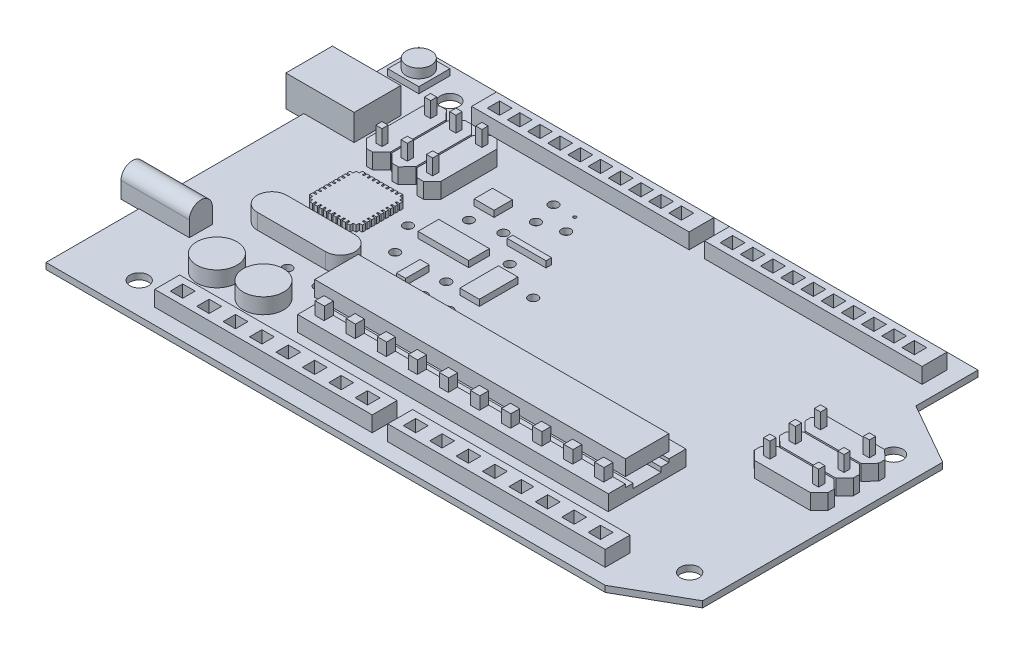
from build123d import *

# Parameters (mm, degrees)
BOSS_EXTRUDE2_DEPTH       = 2
SKETCH3_W                 = 70
SKETCH3_H                 = 8
BOSS_EXTRUDE3_DEPTH       = 5
SKETCH4_W                 = 4
SKETCH4_H                 = 4
CUT_EXTRUDE1_DEPTH        = 4
LPATTERN3_COUNT           = 10
LPATTERN3_PITCH           = 6.5
SKETCH5_W                 = 4
SKETCH5_H                 = 4
CUT_EXTRUDE2_DEPTH        = 4
LPATTERN4_COUNT           = 10
LPATTERN4_PITCH           = 6.5
SKETCH6_W                 = 70
SKETCH6_H                 = 8
BOSS_EXTRUDE7_DEPTH       = 5
SKETCH7_W                 = 4
SKETCH7_H                 = 4
CUT_EXTRUDE3_DEPTH        = 4
LPATTERN5_COUNT           = 8
LPATTERN5_PITCH           = 8.5
SKETCH8_W                 = 4
SKETCH8_H                 = 4
CUT_EXTRUDE4_DEPTH        = 4
LPATTERN6_COUNT           = 8
LPATTERN6_PITCH           = 8.5
SKETCH9_R                 = 3
CUT_EXTRUDE5_DEPTH        = 4
SKETCH10_W                = 100
SKETCH10_H                = 25
BOSS_EXTRUDE8_DEPTH       = 5
SKETCH11_W                = 9
SKETCH11_H                = 2.5
CUT_EXTRUDE6_DEPTH        = 100
SKETCH13_W                = 3
SKETCH13_H                = 3
CUT_EXTRUDE7_DEPTH        = 4
LPATTERN7_COUNT           = 10
LPATTERN7_PITCH           = 10
SKETCH15_W                = 3
SKETCH15_H                = 3
SKETCH15_H_2              = 2.867766304
BOSS_EXTRUDE9_DEPTH       = 8
LPATTERN8_COUNT           = 10
LPATTERN8_PITCH           = 10
BOSS_EXTRUDE10_DEPTH      = 7
BOSS_EXTRUDE10_DEPTH_BACK = 1
SKETCH17_W                = 100
SKETCH17_H                = 14.011821037
SKETCH18_W                = 14.028012235
SKETCH18_H                = 3.073490992
CUT_EXTRUDE8_DEPTH        = 100
BOSS_EXTRUDE13_DEPTH      = 5
SKETCH21_W                = 2
SKETCH21_H                = 2
BOSS_EXTRUDE14_DEPTH      = 5
BOSS_EXTRUDE15_DEPTH      = 5
SKETCH23_W                = 2
SKETCH23_H                = 2
BOSS_EXTRUDE16_DEPTH      = 5
SKETCH24_W                = 15
SKETCH24_H                = 15
BOSS_EXTRUDE17_DEPTH      = 2
SKETCH26_W                = 1
SKETCH26_H                = 1
BOSS_EXTRUDE19_DEPTH      = 2
LPATTERN9_COUNT           = 9
LPATTERN9_PITCH           = 1.5
SKETCH27_W                = 1
SKETCH27_H                = 1
BOSS_EXTRUDE20_DEPTH      = 2
LPATTERN10_COUNT          = 9
LPATTERN10_PITCH          = 1.5
SKETCH28_W                = 1
SKETCH28_H                = 1
BOSS_EXTRUDE24_DEPTH      = 2
SKETCH31_W                = 1
SKETCH31_H                = 1
BOSS_EXTRUDE25_DEPTH      = 2
BOSS_EXTRUDE26_DEPTH      = 2
BOSS_EXTRUDE26_DEPTH_BACK = 20
CUT_EXTRUDE9_DEPTH        = 15
BOSS_EXTRUDE27_DEPTH      = 2
BOSS_EXTRUDE27_DEPTH_BACK = 20
SKETCH35_W                = 15
SKETCH35_H                = 10
CUT_EXTRUDE10_DEPTH       = 20
SKETCH37_W                = 2
SKETCH37_H                = 2
BOSS_EXTRUDE28_DEPTH      = 18
SKETCH38_R                = 6.5
BOSS_EXTRUDE29_DEPTH      = 5
BOSS_EXTRUDE30_DEPTH      = 5
SKETCH40_W                = 16.318119351
SKETCH40_H                = 6.663064339
SKETCH40_W_2              = 2.965577879
SKETCH40_H_2              = 7.583134105
SKETCH40_W_3              = 6.396721668
SKETCH40_H_3              = 5.884641135
SKETCH40_W_4              = 12.501321605
SKETCH40_H_4              = 1.772437407
SKETCH40_W_5              = 6.250660803
SKETCH40_H_5              = 12.411537086
BOSS_EXTRUDE31_DEPTH      = 2
SKETCH41_R                = 1.5
SKETCH41_R_2              = 0.491323985
CUT_EXTRUDE11_DEPTH       = 3
SKETCH42_W                = 10
SKETCH42_H                = 10
BOSS_EXTRUDE32_DEPTH      = 2
SKETCH43_R                = 4
BOSS_EXTRUDE33_DEPTH      = 3


with BuildPart() as part:
    # Sketch2 → Boss-Extrude2 (new body)
    with BuildSketch(Plane(origin=(0, 0, 0), x_dir=(1, 0, 0), z_dir=(0, 1, 0))):
        Polygon((-134.193548387, 60.967741935), (-134.193548387, -59.032258065), (45.806451613, -59.032258065), (65.806451613, -47.674441373), (65.806451613, 29.609925244), (45.806451613, 40.967741935), (45.806451613, 60.967741935), align=None)
    extrude(amount=BOSS_EXTRUDE2_DEPTH)

    # Sketch3 → Boss-Extrude3 (add)
    with BuildSketch(Plane(origin=(0, 2, 0), x_dir=(1, 0, 0), z_dir=(0, 1, 0))):
        with Locations((-69.193548387, 51.967741935)):
            Rectangle(SKETCH3_W, SKETCH3_H)
        with Locations((5.806451613, 51.967741935)):
            Rectangle(SKETCH3_W, SKETCH3_H)
    extrude(amount=BOSS_EXTRUDE3_DEPTH)

    # Sketch4 → Cut-Extrude1 (cut)
    with BuildSketch(Plane(origin=(0, 7, 0), x_dir=(1, 0, 0), z_dir=(0, 1, 0))):
        with Locations((-99.193548387, 51.967741935)):
            Rectangle(SKETCH4_W, SKETCH4_H)
    cut_extrude1 = extrude(amount=-CUT_EXTRUDE1_DEPTH, mode=Mode.SUBTRACT)

    # LPattern3: Cut-Extrude1 ×10
    with Locations(*[(i * LPATTERN3_PITCH, 0, 0) for i in range(1, LPATTERN3_COUNT)]):
        add(cut_extrude1, mode=Mode.SUBTRACT)

    # Sketch5 → Cut-Extrude2 (cut)
    with BuildSketch(Plane(origin=(0, 7, 0), x_dir=(1, 0, 0), z_dir=(0, 1, 0))):
        with Locations((-24.193548387, 51.967741935)):
            Rectangle(SKETCH5_W, SKETCH5_H)
    cut_extrude2 = extrude(amount=-CUT_EXTRUDE2_DEPTH, mode=Mode.SUBTRACT)

    # LPattern4: Cut-Extrude2 ×10
    with Locations(*[(i * LPATTERN4_PITCH, 0, 0) for i in range(1, LPATTERN4_COUNT)]):
        add(cut_extrude2, mode=Mode.SUBTRACT)

    # Sketch6 → Boss-Extrude7 (add)
    with BuildSketch(Plane(origin=(0, 2, 0), x_dir=(1, 0, 0), z_dir=(0, 1, 0))):
        with Locations((-69.193548387, -50.032258065)):
            Rectangle(SKETCH6_W, SKETCH6_H)
        with Locations((5.806451613, -50.032258065)):
            Rectangle(SKETCH6_W, SKETCH6_H)
    extrude(amount=BOSS_EXTRUDE7_DEPTH)

    # Sketch7 → Cut-Extrude3 (cut)
    with BuildSketch(Plane(origin=(0, 7, 0), x_dir=(1, 0, 0), z_dir=(0, 1, 0))):
        with Locations((-99.193548387, -50.032258065)):
            Rectangle(SKETCH7_W, SKETCH7_H)
    cut_extrude3 = extrude(amount=-CUT_EXTRUDE3_DEPTH, mode=Mode.SUBTRACT)

    # LPattern5: Cut-Extrude3 ×8
    with Locations(*[(i * LPATTERN5_PITCH, 0, 0) for i in range(1, LPATTERN5_COUNT)]):
        add(cut_extrude3, mode=Mode.SUBTRACT)

    # Sketch8 → Cut-Extrude4 (cut)
    with BuildSketch(Plane(origin=(0, 7, 0), x_dir=(1, 0, 0), z_dir=(0, 1, 0))):
        with Locations((-24.193548387, -50.032258065)):
            Rectangle(SKETCH8_W, SKETCH8_H)
    cut_extrude4 = extrude(amount=-CUT_EXTRUDE4_DEPTH, mode=Mode.SUBTRACT)

    # LPattern6: Cut-Extrude4 ×8
    with Locations(*[(i * LPATTERN6_PITCH, 0, 0) for i in range(1, LPATTERN6_COUNT)]):
        add(cut_extrude4, mode=Mode.SUBTRACT)

    # Sketch9 → Cut-Extrude5 (cut)
    with BuildSketch(Plane(origin=(0, 2, 0), x_dir=(1, 0, 0), z_dir=(0, 1, 0))):
        with Locations(Location((55.806451613, 23.78883359, 0), (0, 0, 270))):
            Circle(SKETCH9_R)
        with Locations(Location((55.806451613, -41.853349719, 0), (0, 0, 270))):
            Circle(SKETCH9_R)
        with Locations(Location((-114.193548387, 50.967741935, 0), (0, 0, 270))):
            Circle(SKETCH9_R)
        with Locations(Location((-114.193548387, -49.032258065, 0), (0, 0, 270))):
            Circle(SKETCH9_R)
    extrude(amount=-CUT_EXTRUDE5_DEPTH, mode=Mode.SUBTRACT)

    # Sketch10 → Boss-Extrude8 (add)
    with BuildSketch(Plane(origin=(0, 2, 0), x_dir=(1, 0, 0), z_dir=(0, 1, 0))):
        with Locations((-24.193548387, -25.532258065)):
            Rectangle(SKETCH10_W, SKETCH10_H)
    extrude(amount=BOSS_EXTRUDE8_DEPTH)

    # Sketch11 → Cut-Extrude6 (cut)
    with BuildSketch(Plane(origin=(25.806451613, 0, 0), x_dir=(0, 0, -1), z_dir=(1, 0, 0))):
        with Locations((-25.532258065, 5.75)):
            Rectangle(SKETCH11_W, SKETCH11_H)
    extrude(amount=-CUT_EXTRUDE6_DEPTH, mode=Mode.SUBTRACT)

    # Sketch13 → Cut-Extrude7 (cut)
    with BuildSketch(Plane(origin=(0, 7, 0), x_dir=(1, 0, 0), z_dir=(0, 1, 0))):
        with Locations((-69.693548387, -17.032258065)):
            Rectangle(SKETCH13_W, SKETCH13_H)
        with Locations((-69.693548387, -34.032258065)):
            Rectangle(SKETCH13_W, SKETCH13_H)
    cut_extrude7 = extrude(amount=-CUT_EXTRUDE7_DEPTH, mode=Mode.SUBTRACT)

    # LPattern7: Cut-Extrude7 ×10
    with Locations(*[(i * LPATTERN7_PITCH, 0, 0) for i in range(1, LPATTERN7_COUNT)]):
        add(cut_extrude7, mode=Mode.SUBTRACT)

    # Sketch15 → Boss-Extrude9 (add)
    with BuildSketch(Plane(origin=(0, 3, 0), x_dir=(1, 0, 0), z_dir=(0, 1, 0))):
        with Locations((-69.693548387, -17.032258065)):
            Rectangle(SKETCH15_W, SKETCH15_H)
        with Locations((-69.693548387, -33.966141217)):
            Rectangle(SKETCH15_W, SKETCH15_H_2)
    boss_extrude9 = extrude(amount=BOSS_EXTRUDE9_DEPTH)

    # LPattern8: Boss-Extrude9 ×10
    with Locations(*[(i * LPATTERN8_PITCH, 0, 0) for i in range(1, LPATTERN8_COUNT)]):
        add(boss_extrude9)

    # Sketch17 → Boss-Extrude10 (add, two sides: drawn at the far end of the back side and taken through both)
    with BuildSketch(Plane(origin=(0, 7, 0), x_dir=(1, 0, 0), z_dir=(0, 1, 0)).offset(-BOSS_EXTRUDE10_DEPTH_BACK)):
        with Locations((-24.193548387, -25.537676656)):
            Rectangle(SKETCH17_W, SKETCH17_H)
    extrude(amount=BOSS_EXTRUDE10_DEPTH + BOSS_EXTRUDE10_DEPTH_BACK)

    # Sketch18 → Cut-Extrude8 (cut)
    with BuildSketch(Plane(origin=(25.806451613, 0, 0), x_dir=(0, 0, -1), z_dir=(1, 0, 0))):
        with Locations((-25.545772255, 7.502419197)):
            Rectangle(SKETCH18_W, SKETCH18_H)
    extrude(amount=-CUT_EXTRUDE8_DEPTH, mode=Mode.SUBTRACT)

    # Sketch20 → Boss-Extrude13 (add)
    with BuildSketch(Plane(origin=(0, 2, 0), x_dir=(1, 0, 0), z_dir=(0, 1, 0))):
        Polygon((39.928820434, 18.78883359), (57.928820434, 18.78883359), (60.806451613, 16.010481776), (60.806451613, 14.010481776), (58.028099799, 11.132850598), (40.028099799, 11.132850598), (37.150468621, 13.911202411), (37.150468621, 15.911202411), align=None)
        Polygon((39.928820434, 10.632850598), (57.928820434, 10.632850598), (60.806451613, 7.854498784), (60.806451613, 5.854498784), (58.028099799, 2.976867605), (40.028099799, 2.976867605), (37.150468621, 5.755219419), (37.150468621, 7.755219419), align=None)
        Polygon((39.928820434, 2.476867605), (57.928820434, 2.476867605), (60.806451613, -0.301484208), (60.806451613, -2.301484208), (58.028099799, -5.179115387), (40.028099799, -5.179115387), (37.150468621, -2.400763573), (37.150468621, -0.400763573), align=None)
    extrude(amount=BOSS_EXTRUDE13_DEPTH)

    # Sketch21 → Boss-Extrude14 (add)
    with BuildSketch(Plane(origin=(0, 7, 0), x_dir=(1, 0, 0), z_dir=(0, 1, 0))):
        with Locations((41.150468621, 14.93883359)):
            Rectangle(SKETCH21_W, SKETCH21_H)
        with Locations((41.150468621, 6.832850598)):
            Rectangle(SKETCH21_W, SKETCH21_H)
        with Locations((41.150468621, -1.369928434)):
            Rectangle(SKETCH21_W, SKETCH21_H)
        with Locations((56.806451613, 14.98883359)):
            Rectangle(SKETCH21_W, SKETCH21_H)
        with Locations((56.806451613, 6.832850598)):
            Rectangle(SKETCH21_W, SKETCH21_H)
        with Locations((56.806451613, -1.323132395)):
            Rectangle(SKETCH21_W, SKETCH21_H)
    extrude(amount=BOSS_EXTRUDE14_DEPTH)

    # Sketch22 → Boss-Extrude15 (add)
    with BuildSketch(Plane(origin=(0, 2, 0), x_dir=(1, 0, 0), z_dir=(0, 1, 0))):
        Polygon((-112.193548387, 40.157420625), (-112.193548387, 22.157420625), (-109.383227077, 19.311002885), (-107.383227077, 19.311002885), (-104.536809337, 22.121324195), (-104.536809337, 40.121324195), (-107.347130647, 42.967741935), (-109.347130647, 42.967741935), align=None)
        Polygon((-104.036809337, 40.09436986), (-104.036809337, 22.09436986), (-101.163437258, 19.311613504), (-99.163437258, 19.311613504), (-96.380680902, 22.184985583), (-96.380680902, 40.184985583), (-99.254052977, 42.967741935), (-101.254052984, 42.967741936), align=None)
        Polygon((-95.880680902, 40.124166197), (-95.880680902, 22.124166197), (-93.037105159, 19.310969254), (-91.037105159, 19.310969253), (-88.223908222, 22.15454499), (-88.223908222, 40.15454499), (-91.067483968, 42.967741936), (-93.067483963, 42.967741935), align=None)
    extrude(amount=BOSS_EXTRUDE15_DEPTH)

    # Sketch23 → Boss-Extrude16 (add)
    with BuildSketch(Plane(origin=(0, 7, 0), x_dir=(1, 0, 0), z_dir=(0, 1, 0))):
        with Locations((-108.393548387, 38.967741935)):
            Rectangle(SKETCH23_W, SKETCH23_H)
        with Locations((-100.236809337, 38.967741935)):
            Rectangle(SKETCH23_W, SKETCH23_H)
        with Locations((-92.080680902, 39.167741936)):
            Rectangle(SKETCH23_W, SKETCH23_H)
        with Locations((-92.080680902, 23.310969254)):
            Rectangle(SKETCH23_W, SKETCH23_H)
        with Locations((-100.236809337, 23.311613504)):
            Rectangle(SKETCH23_W, SKETCH23_H)
        with Locations((-108.393548387, 23.311002885)):
            Rectangle(SKETCH23_W, SKETCH23_H)
    extrude(amount=BOSS_EXTRUDE16_DEPTH)

    # Sketch24 → Boss-Extrude17 (add)
    with BuildSketch(Plane(origin=(0, 2, 0), x_dir=(1, 0, 0), z_dir=(0, 1, 0))):
        with Locations((-100.193548387, 6.811613504)):
            Rectangle(SKETCH24_W, SKETCH24_H)
    extrude(amount=BOSS_EXTRUDE17_DEPTH)

    # Sketch26 → Boss-Extrude19 (add)
    with BuildSketch(Plane(origin=(0, 2, 0), x_dir=(1, 0, 0), z_dir=(0, 1, 0))):
        with Locations((-106.193548387, 14.811613504)):
            Rectangle(SKETCH26_W, SKETCH26_H)
    boss_extrude19 = extrude(amount=BOSS_EXTRUDE19_DEPTH)

    # LPattern9: Boss-Extrude19 ×9
    with Locations(*[(i * LPATTERN9_PITCH, 0, 0) for i in range(1, LPATTERN9_COUNT)]):
        add(boss_extrude19)

    # Sketch27 → Boss-Extrude20 (add)
    with BuildSketch(Plane(origin=(0, 2, 0), x_dir=(1, 0, 0), z_dir=(0, 1, 0))):
        with Locations((-106.193548387, -1.188386496)):
            Rectangle(SKETCH27_W, SKETCH27_H)
    boss_extrude20 = extrude(amount=BOSS_EXTRUDE20_DEPTH)

    # LPattern10: Boss-Extrude20 ×9
    with Locations(*[(i * LPATTERN10_PITCH, 0, 0) for i in range(1, LPATTERN10_COUNT)]):
        add(boss_extrude20)

    # Sketch28 → Boss-Extrude24 (add)
    with BuildSketch(Plane(origin=(0, 2, 0), x_dir=(1, 0, 0), z_dir=(0, 1, 0))):
        with Locations((-92.193548387, 12.811613504)):
            Rectangle(SKETCH28_W, SKETCH28_H)
        with Locations((-92.193548387, 11.311613504)):
            Rectangle(SKETCH28_W, SKETCH28_H)
        with Locations((-92.193548387, 9.811613504)):
            Rectangle(SKETCH28_W, SKETCH28_H)
        with Locations((-92.193548387, 8.311613504)):
            Rectangle(SKETCH28_W, SKETCH28_H)
        with Locations((-92.193548387, 6.811613504)):
            Rectangle(SKETCH28_W, SKETCH28_H)
        with Locations((-92.193548387, 5.311613504)):
            Rectangle(SKETCH28_W, SKETCH28_H)
        with Locations((-92.193548387, 3.811613504)):
            Rectangle(SKETCH28_W, SKETCH28_H)
        with Locations((-92.193548387, 2.311613504)):
            Rectangle(SKETCH28_W, SKETCH28_H)
        with Locations((-92.193548387, 0.811613504)):
            Rectangle(SKETCH28_W, SKETCH28_H)
    extrude(amount=BOSS_EXTRUDE24_DEPTH)

    # Sketch31 → Boss-Extrude25 (add)
    with BuildSketch(Plane(origin=(0, 2, 0), x_dir=(1, 0, 0), z_dir=(0, 1, 0))):
        with Locations((-108.193548387, 12.811613504)):
            Rectangle(SKETCH31_W, SKETCH31_H)
        with Locations((-108.193548387, 11.311613504)):
            Rectangle(SKETCH31_W, SKETCH31_H)
        with Locations((-108.193548387, 9.811613504)):
            Rectangle(SKETCH31_W, SKETCH31_H)
        with Locations((-108.193548387, 8.311613504)):
            Rectangle(SKETCH31_W, SKETCH31_H)
        with Locations((-108.193548387, 6.811613504)):
            Rectangle(SKETCH31_W, SKETCH31_H)
        with Locations((-108.193548387, 5.311613504)):
            Rectangle(SKETCH31_W, SKETCH31_H)
        with Locations((-108.193548387, 3.811613504)):
            Rectangle(SKETCH31_W, SKETCH31_H)
        with Locations((-108.193548387, 2.311613504)):
            Rectangle(SKETCH31_W, SKETCH31_H)
        with Locations((-108.193548387, 0.811613504)):
            Rectangle(SKETCH31_W, SKETCH31_H)
    extrude(amount=BOSS_EXTRUDE25_DEPTH)

    # Sketch33 → Boss-Extrude26 (add, two sides: drawn at the far end of the back side and taken through both)
    with BuildSketch(Plane(origin=(-120, 0, 0), x_dir=(0, 0, -1), z_dir=(1, 0, 0)).offset(-BOSS_EXTRUDE26_DEPTH_BACK)):
        with BuildLine():
            Line((-21.68252287, 1.744360005), (-21.68252287, 6.992995978))
            ThreePointArc((-21.68252287, 6.992995978), (-25.381571487, 10.692044596), (-29.080620105, 6.992995978))
            Line((-29.080620105, 6.992995978), (-29.080620105, 1.744360005))
            Line((-29.080620105, 1.744360005), (-21.68252287, 1.744360005))
        make_face()
    extrude(amount=BOSS_EXTRUDE26_DEPTH + BOSS_EXTRUDE26_DEPTH_BACK)

    # Sketch34 → Cut-Extrude9 (cut)
    with BuildSketch(Plane.ZY.offset(140)):
        with BuildLine():
            Line((22.88252287, 3.244360005), (27.880620105, 3.244360005))
            Line((27.880620105, 3.244360005), (27.880620105, 6.987580658))
            ThreePointArc((27.880620105, 6.987580658), (25.381571487, 9.486629275), (22.88252287, 6.987580658))
            Line((22.88252287, 6.987580658), (22.88252287, 3.244360005))
        make_face()
    extrude(amount=-CUT_EXTRUDE9_DEPTH, mode=Mode.SUBTRACT)

    # Sketch35 → Boss-Extrude27 (add, two sides: drawn at the far end of the back side and taken through both)
    with BuildSketch(Plane(origin=(-120, 0, 0), x_dir=(0, 0, -1), z_dir=(1, 0, 0)).offset(-BOSS_EXTRUDE27_DEPTH_BACK)):
        with Locations((31.467741935, 5.412689299)):
            Rectangle(SKETCH35_W, SKETCH35_H)
    extrude(amount=BOSS_EXTRUDE27_DEPTH + BOSS_EXTRUDE27_DEPTH_BACK)

    # Sketch36 → Cut-Extrude10 (cut)
    with BuildSketch(Plane.ZY.offset(140)):
        Polygon((-35.467741935, 1.912689299), (-27.467741935, 1.912689299), (-27.467741935, 6.550310648), (-29.558566117, 8.412689299), (-33.605363284, 8.412689299), (-35.467741935, 6.321865117), align=None)
    extrude(amount=-CUT_EXTRUDE10_DEPTH, mode=Mode.SUBTRACT)

    # Sketch37 → Boss-Extrude28 (add)
    with BuildSketch(Plane.ZY.offset(120)):
        with Locations((-31.467741935, 4.912689299)):
            Rectangle(SKETCH37_W, SKETCH37_H)
    extrude(amount=BOSS_EXTRUDE28_DEPTH)

    # Sketch38 → Boss-Extrude29 (add)
    with BuildSketch(Plane(origin=(0, 2, 0), x_dir=(1, 0, 0), z_dir=(0, 1, 0))):
        with Locations(Location((-104.193548387, -34.032258065, 0), (0, 0, 270))):
            Circle(SKETCH38_R)
        with Locations(Location((-89.193548387, -34.032258065, 0), (0, 0, 270))):
            Circle(SKETCH38_R)
    extrude(amount=BOSS_EXTRUDE29_DEPTH)

    # Sketch39 → Boss-Extrude30 (add)
    with BuildSketch(Plane(origin=(0, 2, 0), x_dir=(1, 0, 0), z_dir=(0, 1, 0))):
        with BuildLine():
            Line((-109.193548387, -6.571456927), (-87.193548387, -6.571456927))
            ThreePointArc((-87.193548387, -6.571456927), (-82.463147818, -11.301857496), (-87.193548387, -16.032258065))
            Line((-87.193548387, -16.032258065), (-109.193548387, -16.032258065))
            ThreePointArc((-109.193548387, -16.032258065), (-113.923948956, -11.301857496), (-109.193548387, -6.571456927))
        make_face()
    extrude(amount=BOSS_EXTRUDE30_DEPTH)

    # Sketch40 → Boss-Extrude31 (add)
    with BuildSketch(Plane(origin=(0, 2, 0), x_dir=(1, 0, 0), z_dir=(0, 1, 0))):
        with Locations((-72.841338053, 10.850325943)):
            Rectangle(SKETCH40_W, SKETCH40_H)
        with Locations((-71.358549114, -3.791567053)):
            Rectangle(SKETCH40_W_2, SKETCH40_H_2)
        with Locations((-77.802036894, 28.560973651)):
            Rectangle(SKETCH40_W_3, SKETCH40_H_3)
        with Locations((-58.431617575, 20.789290115)):
            Rectangle(SKETCH40_W_4, SKETCH40_H_4)
        with Locations((-55.306287174, 4.644557401)):
            Rectangle(SKETCH40_W_5, SKETCH40_H_5)
    extrude(amount=BOSS_EXTRUDE31_DEPTH)

    # Sketch41 → Cut-Extrude11 (cut)
    with BuildSketch(Plane(origin=(0, 2, 0), x_dir=(1, 0, 0), z_dir=(0, 1, 0))):
        with Locations(Location((-68.580084956, 38.717944025, 0), (0, 0, 270))):
            Circle(SKETCH41_R)
        with Locations(Location((-66.590423146, 31.067244796, 0), (0, 0, 270))):
            Circle(SKETCH41_R)
        with Locations(Location((-61.718577852, 38.717944025, 0), (0, 0, 270))):
            Circle(SKETCH41_R_2)
        with Locations(Location((-59.07419347, 33.269773479, 0), (0, 0, 270))):
            Circle(SKETCH41_R)
        with Locations(Location((-68.792951829, 22.798302875, 0), (0, 0, 270))):
            Circle(SKETCH41_R)
        with Locations(Location((-77.918197512, 20.824232377, 0), (0, 0, 270))):
            Circle(SKETCH41_R)
        with Locations(Location((-86.188518662, 9.492012619, 0), (0, 0, 270))):
            Circle(SKETCH41_R)
        with Locations(Location((-64.387894463, 0, 0), (0, 0, 270))):
            Circle(SKETCH41_R)
        with Locations(Location((-64.387894463, -7.526474775, 0), (0, 0, 270))):
            Circle(SKETCH41_R)
        with Locations(Location((-56.135891424, -7.526474775, 0), (0, 0, 270))):
            Circle(SKETCH41_R)
        with Locations(Location((-80.818061029, 0, 0), (0, 0, 270))):
            Circle(SKETCH41_R)
        with Locations(Location((-59.07419347, 15.118249874, 0), (0, 0, 270))):
            Circle(SKETCH41_R)
        with Locations(Location((-45.893140411, 9.492012619, 0), (0, 0, 270))):
            Circle(SKETCH41_R)
        with Locations(Location((-83.73910172, -21.755186398, 0), (0, 0, 270))):
            Circle(SKETCH41_R)
        with Locations(Location((-93.748650837, -21.755186398, 0), (0, 0, 270))):
            Circle(SKETCH41_R)
    extrude(amount=-CUT_EXTRUDE11_DEPTH, mode=Mode.SUBTRACT)

    # Sketch42 → Boss-Extrude32 (add)
    with BuildSketch(Plane(origin=(0, 2, 0), x_dir=(1, 0, 0), z_dir=(0, 1, 0))):
        with Locations((-126.193548387, 52.967741935)):
            Rectangle(SKETCH42_W, SKETCH42_H)
    extrude(amount=BOSS_EXTRUDE32_DEPTH)

    # Sketch43 → Boss-Extrude33 (add)
    with BuildSketch(Plane(origin=(0, 4, 0), x_dir=(1, 0, 0), z_dir=(0, 1, 0))):
        with Locations(Location((-126.193548387, 52.967741935, 0), (0, 0, 270))):
            Circle(SKETCH43_R)
    extrude(amount=BOSS_EXTRUDE33_DEPTH)


solid = part.part
